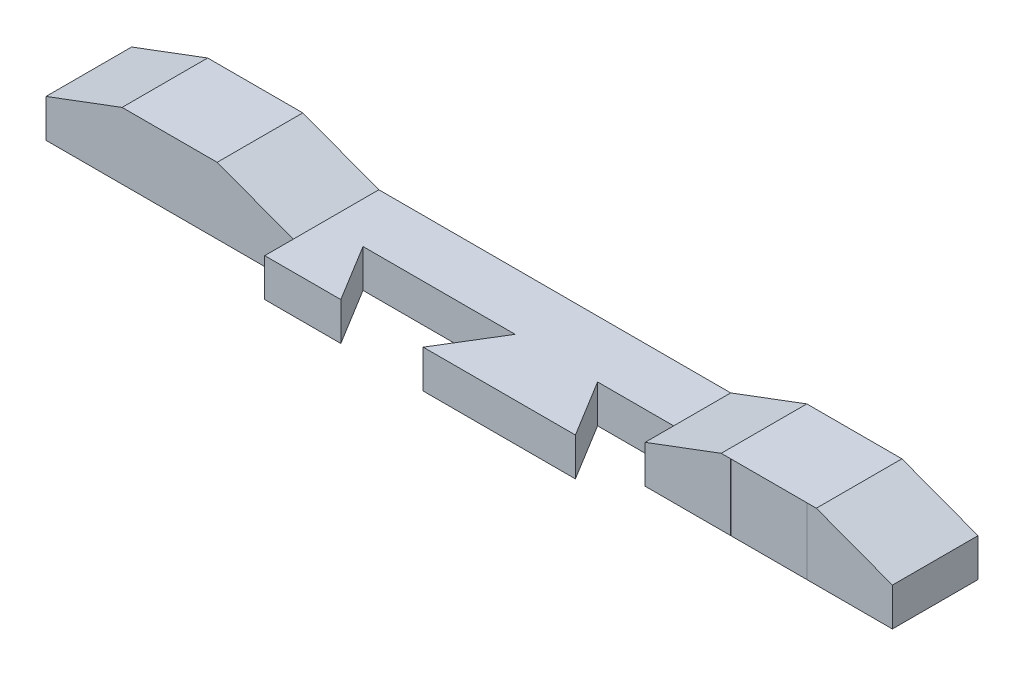
from build123d import *

# Parameters (mm, degrees)
EXTRUDE_1_DEPTH          = 4
CUT_EXTRUDE_6_DEPTH      = 41.841155713
CUT_EXTRUDE_6_DEPTH_BACK = 41.841155713
EXTRUDE_2_DEPTH          = 0.5
SKETCH_8_W               = 4
SKETCH_8_H               = 3.5
CUT_EXTRUDE_7_DEPTH      = 0.001


with BuildPart() as part:
    # 草图4 → 凸台-拉伸1 (new body)
    with BuildSketch(Plane.XY):
        Polygon((17.75, -1.5), (8.5, -1.5), (4.5, 0), (4, 0), (0, 0), (-0.5, 0), (-4.5, -1.5), (-4.5, -3.5), (17.75, -3.5), align=None)
    extrude(amount=EXTRUDE_1_DEPTH)

    # 镜向1: part across plane


with BuildPart() as part_1:
    add(part.part)
    add(part.part.mirror(Plane.XY.offset(4)))

    # 镜向2: part across plane


with BuildPart() as part_2:
    add(part_1.part)
    add(part_1.part.mirror(Plane(origin=(17.75, 0, 4), x_dir=(0, 0, 1), z_dir=(1, 0, 0))))

    # 草图6 → 切除-拉伸6 (cut, two sides: drawn at the far end of the back side and taken through both)
    with BuildSketch(Plane(origin=(0, -1.5, 0), x_dir=(1, 0, 0), z_dir=(0, 1, 0)).offset(-CUT_EXTRUDE_6_DEPTH_BACK)):
        Polygon((18.666666667, -2.5), (10.666666667, -2.5), (12.5, -5.5), (8.5, -5.5), (8.5, -4), (-4.5, -4), (-4.5, -8), (40, -8), (40, -4), (27, -4), (27, -2.5), (23, -2.5), (24.833333333, -5.5), (16.833333333, -5.5), align=None)
    extrude(amount=CUT_EXTRUDE_6_DEPTH + CUT_EXTRUDE_6_DEPTH_BACK, mode=Mode.SUBTRACT)

    # 草图7 → 凸台-拉伸2 (add)
    with BuildSketch(Plane(origin=(0, 0, 0), x_dir=(-1, 0, 0), z_dir=(0, 0, -1))):
        Polygon((0.5, 0), (-4.5, 0), (-8.5, -1.5), (-27, -1.5), (-31, 0), (-36, 0), (-40, -1.5), (-40, -3.5), (4.5, -3.5), (4.5, -1.5), align=None)
    extrude(amount=EXTRUDE_2_DEPTH)

    # 草图8 → 切除-拉伸7 (cut)
    with BuildSketch(Plane.XY.offset(4)):
        with Locations((33.5, -1.75)):
            Rectangle(SKETCH_8_W, SKETCH_8_H)
    extrude(amount=-CUT_EXTRUDE_7_DEPTH, mode=Mode.SUBTRACT)


solid = part_2.part
